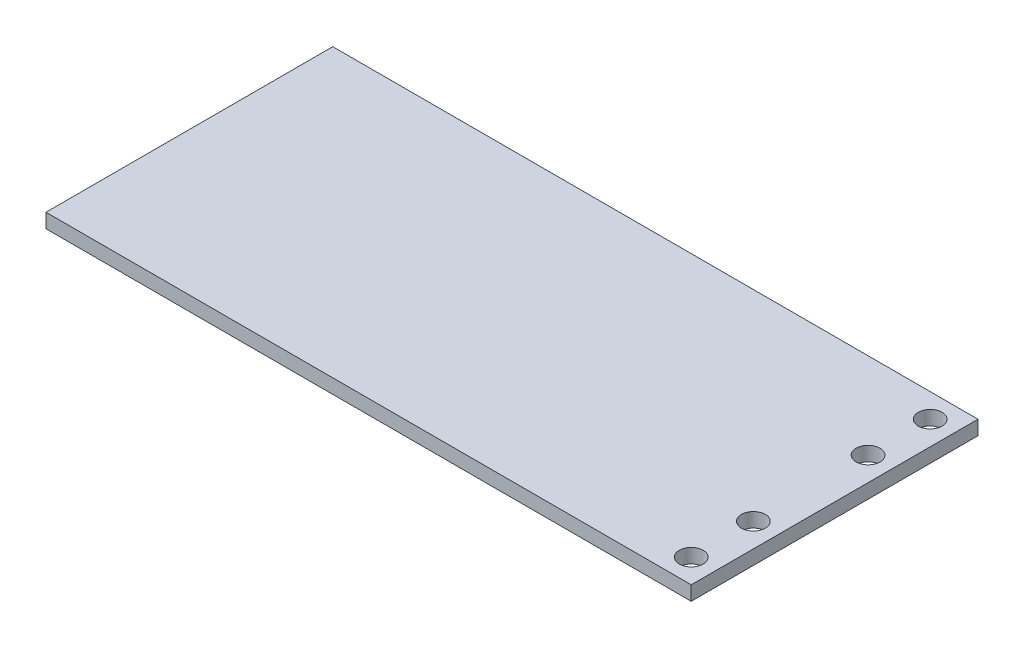
from build123d import *

# Parameters (mm, degrees)
SKETCH1_W           = 135
SKETCH1_H           = 60
SKETCH1_R           = 2.5
BOSS_EXTRUDE1_DEPTH = 3


with BuildPart() as part:
    # Sketch1 → Boss-Extrude1 (new body)
    with BuildSketch(Plane(origin=(0, 0, 0), x_dir=(1, 0, 0), z_dir=(0, 1, 0))):
        with Locations((67.5, 30)):
            Rectangle(SKETCH1_W, SKETCH1_H)
        with Locations((130, 5)):
            Circle(SKETCH1_R, mode=Mode.SUBTRACT)
        with Locations((130, 18)):
            Circle(SKETCH1_R, mode=Mode.SUBTRACT)
        with Locations((130, 42)):
            Circle(SKETCH1_R, mode=Mode.SUBTRACT)
        with Locations((130, 55)):
            Circle(SKETCH1_R, mode=Mode.SUBTRACT)
    extrude(amount=BOSS_EXTRUDE1_DEPTH)


solid = part.part
